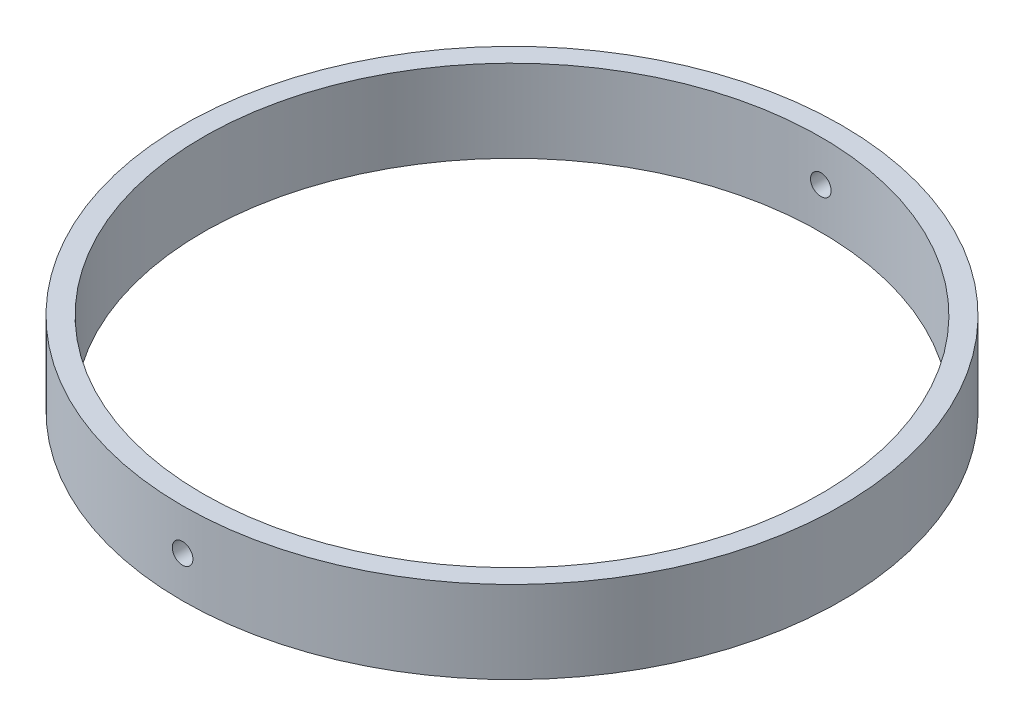
from build123d import *

# Parameters (mm, degrees)
SKETCH1_R               = 101.6
SKETCH1_R_2             = 95.25
BOSS_EXTRUDE1_DEPTH     = 25.4
CUT_EXTRUDE1_DEPTH      = 146.911891222
CUT_EXTRUDE1_DEPTH_BACK = 146.911891222
SKETCH2_R               = 3.175


with BuildPart() as part:
    # Sketch1 → Boss-Extrude1 (new body)
    with BuildSketch(Plane(origin=(0, 0, 0), x_dir=(1, 0, 0), z_dir=(0, 1, 0))):
        Circle(SKETCH1_R)
        Circle(SKETCH1_R_2, mode=Mode.SUBTRACT)
    extrude(amount=BOSS_EXTRUDE1_DEPTH)

    # Sketch2 → Cut-Extrude1 (cut, two sides: drawn at the far end of the back side and taken through both)
    with BuildSketch(Plane.XY.offset(-CUT_EXTRUDE1_DEPTH_BACK)):
        with Locations((0, 12.7)):
            Circle(SKETCH2_R)
    extrude(amount=CUT_EXTRUDE1_DEPTH + CUT_EXTRUDE1_DEPTH_BACK, mode=Mode.SUBTRACT)


solid = part.part
